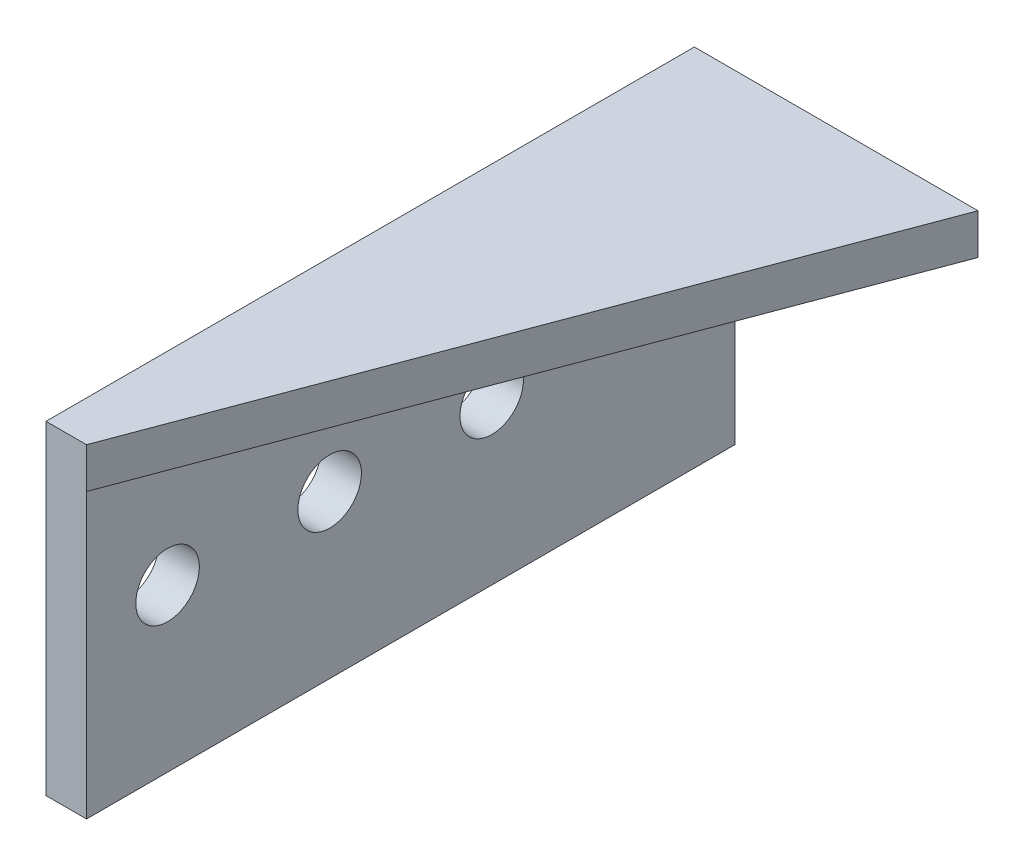
from build123d import *

# Parameters (mm, degrees)
BOSS_EXTRUDE1_DEPTH = 50.8
SKETCH5_R           = 2.4892
CUT_EXTRUDE1_DEPTH  = 61.989758362
CUT_EXTRUDE2_DEPTH  = 61.989758362


with BuildPart() as part:
    # Sketch2 → Boss-Extrude1 (new body)
    with BuildSketch(Plane.XY):
        Polygon((0, 0), (0, -25.4), (3.175, -25.4), (3.175, -3.175), (25.4, -3.175), (25.4, 0), align=None)
    extrude(amount=BOSS_EXTRUDE1_DEPTH)

    # Sketch5 → Cut-Extrude1 (cut, through all)
    with BuildSketch(Plane(origin=(3.175, 0, 0), x_dir=(0, 0, -1), z_dir=(1, 0, 0))):
        with Locations((-6.35, -12.7)):
            Circle(SKETCH5_R)
        with Locations((-19.05, -12.7)):
            Circle(SKETCH5_R)
        with Locations((-31.75, -12.7)):
            Circle(SKETCH5_R)
        with Locations((-44.45, -12.7)):
            Circle(SKETCH5_R)
    extrude(amount=-CUT_EXTRUDE1_DEPTH, mode=Mode.SUBTRACT)

    # Sketch6 → Cut-Extrude2 (cut, through all)
    with BuildSketch(Plane.XZ.offset(3.175)):
        Polygon((25.4, 0), (25.4, 50.8), (3.175, 50.8), (22.225, 0), align=None)
    extrude(amount=-CUT_EXTRUDE2_DEPTH, mode=Mode.SUBTRACT)


solid = part.part
